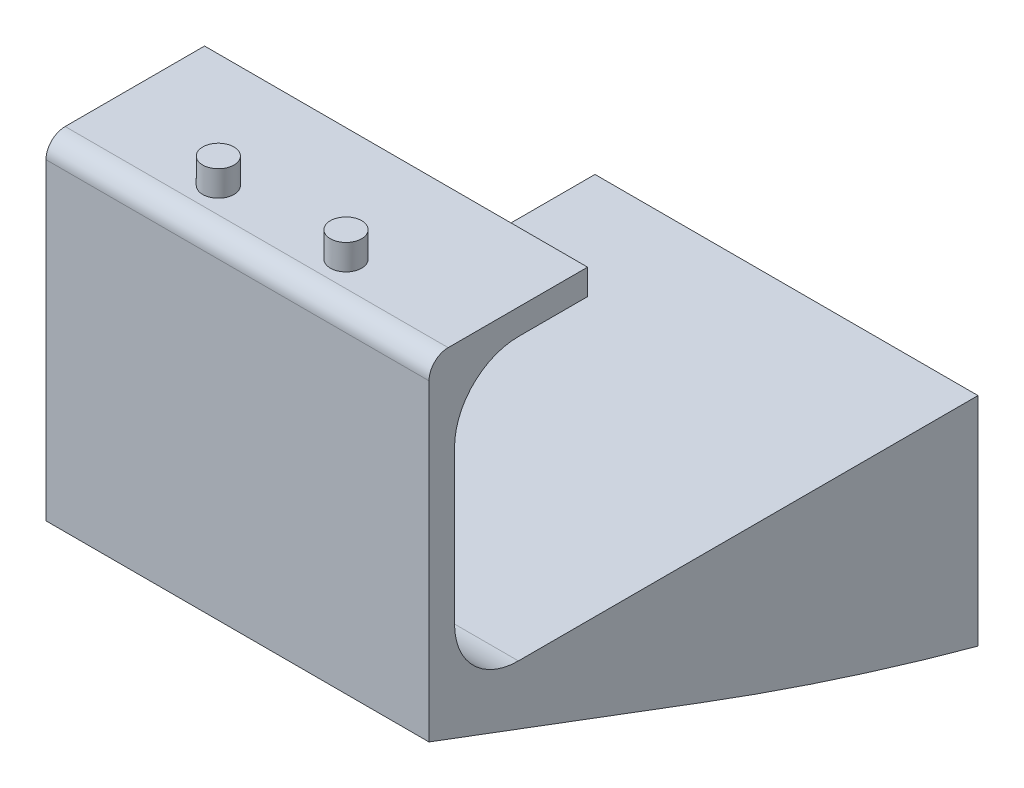
from build123d import *

# Parameters (mm, degrees)
BOSS_EXTRUDE1_DEPTH      = 24.000000335
SKETCH2_W                = 24.000000671
SKETCH2_H                = 21.641136132
BOSS_EXTRUDE2_DEPTH      = 14.161821686
BOSS_EXTRUDE3_DEPTH      = 2.999999665
BOSS_EXTRUDE4_DEPTH      = 21.358863868
SKETCH5_W                = 27.000000671
SKETCH5_H                = 43
BOSS_EXTRUDE5_DEPTH      = 24.000001
CUT_EXTRUDE1_DEPTH       = 6.152247735
SKETCH7_W                = 24.000000671
SKETCH7_H                = 40
CUT_EXTRUDE2_DEPTH       = 8.00957395
BOSS_EXTRUDE6_START      = 3
BOSS_EXTRUDE6_DEPTH      = 3
SKETCH9_W                = 41
SKETCH9_H                = 22.000001
CUT_EXTRUDE3_DEPTH       = 66.345237915
SKETCH10_W               = 30.000000671
SKETCH10_H               = 12.420107592
BOSS_EXTRUDE7_DEPTH      = 2
F_5_0_5_DIAMETER_HOLE1_D = 5
FILLET1_R                = 1.5
FILLET2_R                = 5
SKETCH15_R               = 1.225
BOSS_EXTRUDE8_DEPTH      = 2


with BuildPart() as part:
    # Sketch1 → Boss-Extrude1 (new body)
    with BuildSketch(Plane(origin=(18, 0, 0), x_dir=(0, -1, 0), z_dir=(-1, 0, 0))):
        with BuildLine():
            Line((-0.838178314, 3), (-0.838178314, 0))
            Line((-0.838178314, 0), (0, 0))
            ThreePointArc((0, 0), (-0.41433113, 1.501329358), (-0.838178314, 3))
        make_face()
    extrude(amount=-BOSS_EXTRUDE1_DEPTH)

    # Sketch2 → Boss-Extrude2 (add)
    with BuildSketch(Plane(origin=(0, 0.838178314, 0), x_dir=(-1, 0, 0), z_dir=(0, 1, 0))):
        with Locations((-30.000000336, 10.820568066)):
            Rectangle(SKETCH2_W, SKETCH2_H)
    extrude(amount=BOSS_EXTRUDE2_DEPTH)


with BuildPart() as boss_extrude3_tool:
    # Sketch3 → Boss-Extrude3 (new body)
    with BuildSketch(Plane(origin=(42.000000335, 0, 0), x_dir=(0, 0, -1), z_dir=(1, 0, 0))):
        with BuildLine():
            Line((0, 15), (0, 0))
            ThreePointArc((0, 0), (-10.901557165, 3.244484944), (-21.641136132, 6.99042605))
            Line((-21.641136132, 6.99042605), (-43, 15))
            Line((-43, 15), (0, 15))
        make_face()
    extrude(amount=BOSS_EXTRUDE3_DEPTH)


with BuildPart() as part_1:
    add(part.part)


with BuildPart() as part_2:
    # Boss-Extrude3: joined with boss_extrude3_tool
    add(part_1.part.fuse(boss_extrude3_tool.part, tol=0.00001))

    # Sketch4 → Boss-Extrude4 (add)
    with BuildSketch(Plane.XY.offset(21.641136132)):
        Polygon((42.000000671, 15), (42.000000671, 6.99042605), (42.000000671, 0.838178314), (18, 0.838178314), (18, 6.99042605), (18, 15), align=None)
    extrude(amount=BOSS_EXTRUDE4_DEPTH)

    # Sketch5 → Boss-Extrude5 (add)
    with BuildSketch(Plane(origin=(0, 15, 0), x_dir=(-1, 0, 0), z_dir=(0, 1, 0))):
        with Locations((-31.500000336, 21.5)):
            Rectangle(SKETCH5_W, SKETCH5_H)
    extrude(amount=BOSS_EXTRUDE5_DEPTH)

    # Sketch6 → Cut-Extrude1 (cut)
    with BuildSketch(Plane.XZ.offset(-0.838178314)):
        Polygon((18, 3), (42.000000671, 3), (42.000000671, 21.641136132), (42.000000671, 43), (18, 43), align=None)
    extrude(amount=-CUT_EXTRUDE1_DEPTH, mode=Mode.SUBTRACT)

    # Sketch7 → Cut-Extrude2 (cut)
    with BuildSketch(Plane.XZ.offset(-6.99042605)):
        with Locations((30.000000336, 23)):
            Rectangle(SKETCH7_W, SKETCH7_H)
    extrude(amount=-CUT_EXTRUDE2_DEPTH, mode=Mode.SUBTRACT)

    # Sketch8 → Boss-Extrude6 (add)
    with BuildSketch(Plane.ZY.offset(-18).offset(BOSS_EXTRUDE6_START)):
        with BuildLine():
            Line((0, 39.000001), (43, 39.000001))
            Line((43, 39.000001), (43, 15))
            Line((43, 15), (21.641136132, 6.99042605))
            ThreePointArc((21.641136132, 6.99042605), (10.901557165, 3.244484944), (0, 0))
            Line((0, 0), (0, 39.000001))
        make_face()
    extrude(amount=-BOSS_EXTRUDE6_DEPTH)

    # Sketch9 → Cut-Extrude3 (cut, through all)
    with BuildSketch(Plane.ZY.offset(-15)):
        with Locations((20.5, 28.0000005)):
            Rectangle(SKETCH9_W, SKETCH9_H)
    extrude(amount=-CUT_EXTRUDE3_DEPTH, mode=Mode.SUBTRACT)

    # Sketch10 → Boss-Extrude7 (add)
    with BuildSketch(Plane(origin=(0, 39.000001, 0), x_dir=(-1, 0, 0), z_dir=(0, 1, 0))):
        with Locations((-30.000000336, 36.789946204)):
            Rectangle(SKETCH10_W, SKETCH10_H)
    extrude(amount=BOSS_EXTRUDE7_DEPTH)

    # Ø5.0 (5) Diameter Hole1 (through all)
    with Locations(Plane.XY.offset(3)):
        with Locations((36.000000045, 10), (23.999999955, 10)):
            Hole(F_5_0_5_DIAMETER_HOLE1_D / 2)

    # Fillet1
    fillet1_edges = [part_2.edges().sort_by_distance(p)[0] for p in [
        (30.000000335, 41.000001, 43),
    ]]
    fillet(fillet1_edges, radius=FILLET1_R)

    # Fillet2
    fillet2_edges = [part_2.edges().sort_by_distance(p)[0] for p in [
        (30.000000335, 17, 41),
        (30.000000335, 39.000001, 41),
    ]]
    fillet(fillet2_edges, radius=FILLET2_R)

    # Sketch15 → Boss-Extrude8 (add)
    with BuildSketch(Plane(origin=(0, 41.000001, 0), x_dir=(1, 0, 0), z_dir=(0, 1, 0))):
        with Locations((25, -39.5)):
            Circle(SKETCH15_R)
        with Locations((35, -39.5)):
            Circle(SKETCH15_R)
    extrude(amount=BOSS_EXTRUDE8_DEPTH)


solid = part_2.part
